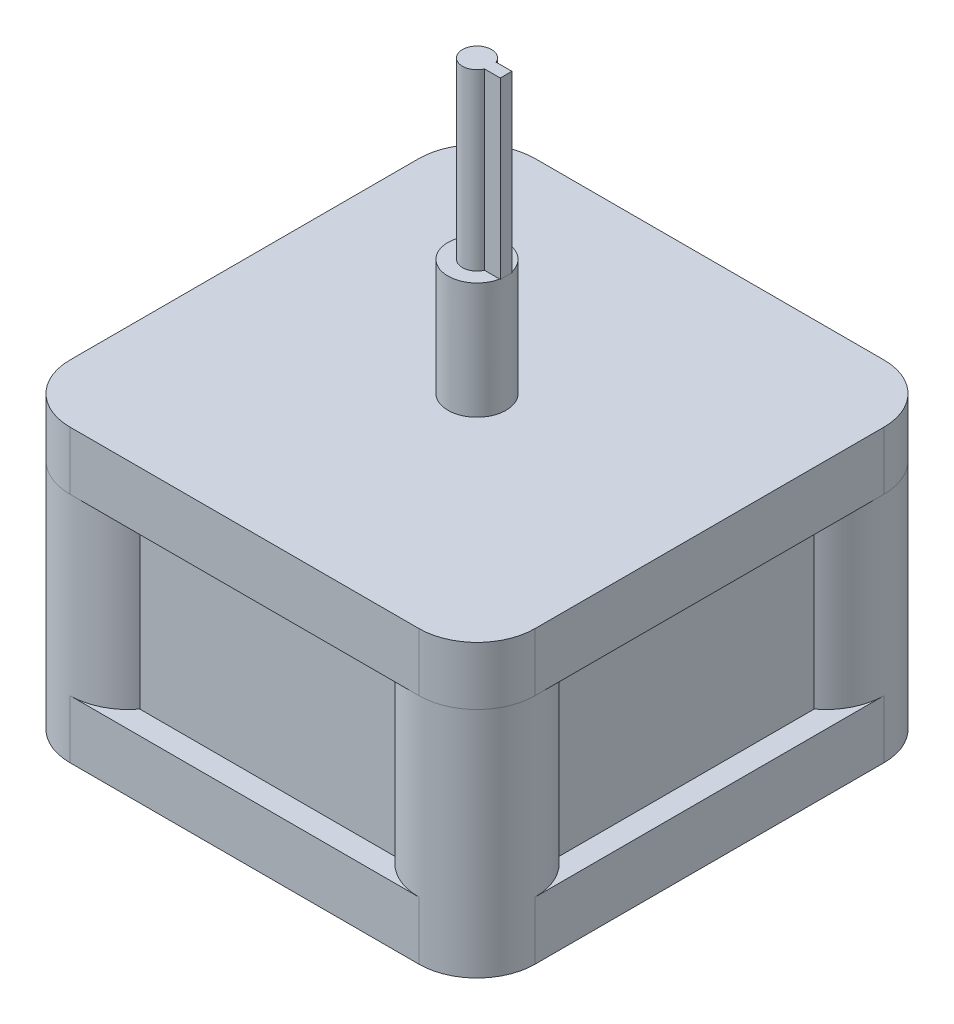
from build123d import *

# Parameters (mm, degrees)
SKETCH1_W           = 50.8
SKETCH1_H           = 50.8
BOSS_EXTRUDE1_DEPTH = 6.35
FILLET1_R           = 6.35
BOSS_EXTRUDE2_START = 19.05
BOSS_EXTRUDE2_DEPTH = 19.05
SKETCH5_W           = 50.8
SKETCH5_H           = 50.8
BOSS_EXTRUDE3_DEPTH = 6.35
FILLET2_R           = 6.35
SKETCH6_R           = 3.175
BOSS_EXTRUDE4_DEPTH = 12.7
BOSS_EXTRUDE5_DEPTH = 19.05


with BuildPart() as part:
    # Sketch1 → Boss-Extrude1 (new body)
    with BuildSketch(Plane(origin=(0, 0, 0), x_dir=(1, 0, 0), z_dir=(0, 1, 0))):
        with Locations((25.4, 25.4)):
            Rectangle(SKETCH1_W, SKETCH1_H)
    extrude(amount=BOSS_EXTRUDE1_DEPTH)

    # Fillet1
    fillet1_edges = [part.edges().sort_by_distance(p)[0] for p in [
        (0, 3.175, -50.8),
        (50.8, 3.175, -50.8),
        (50.8, 3.175, 0),
        (0, 3.175, 0),
    ]]
    fillet(fillet1_edges, radius=FILLET1_R)

    # Sketch3 → Boss-Extrude2 (add)
    with BuildSketch(Plane(origin=(0, 6.35, 0), x_dir=(1, 0, 0), z_dir=(0, 1, 0)).offset(BOSS_EXTRUDE2_START)):
        with BuildLine():
            Line((11.43, 48.26), (39.37, 48.26))
            ThreePointArc((39.37, 48.26), (48.940128061, 48.940128061), (48.26, 39.37))
            Line((48.26, 39.37), (48.26, 11.43))
            ThreePointArc((48.26, 11.43), (48.940128061, 1.859871939), (39.37, 2.54))
            Line((39.37, 2.54), (11.43, 2.54))
            ThreePointArc((11.43, 2.54), (1.859871939, 1.859871939), (2.54, 11.43))
            Line((2.54, 11.43), (2.54, 39.37))
            ThreePointArc((2.54, 39.37), (1.859871939, 48.940128061), (11.43, 48.26))
        make_face()
    extrude(amount=-BOSS_EXTRUDE2_DEPTH)

    # Sketch5 → Boss-Extrude3 (add)
    with BuildSketch(Plane(origin=(0, 25.4, 0), x_dir=(1, 0, 0), z_dir=(0, 1, 0))):
        with Locations((25.4, 25.4)):
            Rectangle(SKETCH5_W, SKETCH5_H)
    extrude(amount=BOSS_EXTRUDE3_DEPTH)

    # Fillet2
    fillet2_edges = [part.edges().sort_by_distance(p)[0] for p in [
        (50.8, 28.575, -50.8),
        (0, 28.575, -50.8),
        (50.8, 28.575, 0),
        (0, 28.575, 0),
    ]]
    fillet(fillet2_edges, radius=FILLET2_R - 0.0001)  # a hair under: the kernel refuses the full size

    # Sketch6 → Boss-Extrude4 (add)
    with BuildSketch(Plane(origin=(0, 31.75, 0), x_dir=(1, 0, 0), z_dir=(0, 1, 0))):
        with Locations(Location((25.4, 25.4, 0), (0, 0, 270))):
            Circle(SKETCH6_R)
    extrude(amount=BOSS_EXTRUDE4_DEPTH)

    # Sketch7 → Boss-Extrude5 (add)
    with BuildSketch(Plane(origin=(0, 44.45, 0), x_dir=(1, 0, 0), z_dir=(0, 1, 0))):
        with BuildLine():
            Line((28.575, 26.035), (28.575, 24.765))
            Line((28.575, 24.765), (26.854967783, 24.765))
            ThreePointArc((26.854967783, 24.765), (23.8125, 25.4), (26.854967783, 26.035))
            Line((26.854967783, 26.035), (28.575, 26.035))
        make_face()
    extrude(amount=BOSS_EXTRUDE5_DEPTH)


solid = part.part
